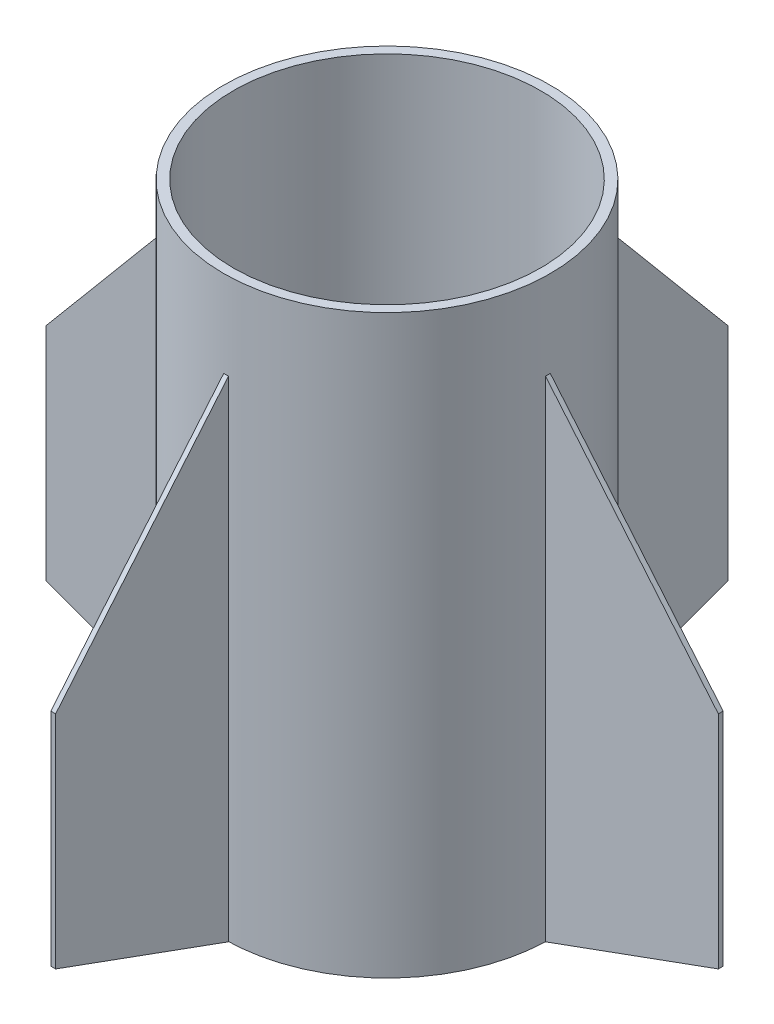
from build123d import *

# Parameters (mm, degrees)
SKETCH1_R           = 107.95
SKETCH1_R_2         = 101.6
BOSS_EXTRUDE1_DEPTH = 381
BOSS_EXTRUDE2_DEPTH = 3.175
BOSS_EXTRUDE3_DEPTH = 3.175
BOSS_EXTRUDE4_DEPTH = 3.175
BOSS_EXTRUDE5_DEPTH = 3.175


with BuildPart() as part:
    # Sketch1 → Boss-Extrude1 (new body)
    with BuildSketch(Plane(origin=(0, 0, 0), x_dir=(1, 0, 0), z_dir=(0, 1, 0))):
        Circle(SKETCH1_R)
        Circle(SKETCH1_R_2, mode=Mode.SUBTRACT)
    extrude(amount=BOSS_EXTRUDE1_DEPTH)


with BuildPart() as body_2:
    # Sketch2 → Boss-Extrude2 (new body)
    with BuildSketch(Plane(origin=(0, 0, 0), x_dir=(0, 0, -1), z_dir=(1, 0, 0))):
        Polygon((-107.95, 323.85), (-222.25, 187.657672757), (-222.25, 41.607672757), (-107.95, 0), align=None)
    extrude(amount=BOSS_EXTRUDE2_DEPTH)


with BuildPart() as body_3:
    # Sketch5 → Boss-Extrude3 (new body)
    with BuildSketch(Plane(origin=(0, 0, 0), x_dir=(0, 0, -1), z_dir=(1, 0, 0))):
        Polygon((107.95, 323.85), (222.25, 187.657672757), (222.25, 41.607672757), (107.95, 0), align=None)
    extrude(amount=BOSS_EXTRUDE3_DEPTH)


with BuildPart() as body_4:
    # Sketch6 → Boss-Extrude4 (new body)
    with BuildSketch(Plane.XY):
        Polygon((-107.95, 323.85), (-222.25, 187.657672757), (-222.25, 41.607672757), (-107.95, 0), align=None)
    extrude(amount=BOSS_EXTRUDE4_DEPTH)


with BuildPart() as body_5:
    # Sketch7 → Boss-Extrude5 (new body)
    with BuildSketch(Plane.XY):
        Polygon((107.95, 323.85), (222.25, 187.657672757), (222.25, 41.607672757), (107.95, 0), align=None)
    extrude(amount=BOSS_EXTRUDE5_DEPTH)


solid = Compound([part.part, body_2.part, body_3.part, body_4.part, body_5.part])
